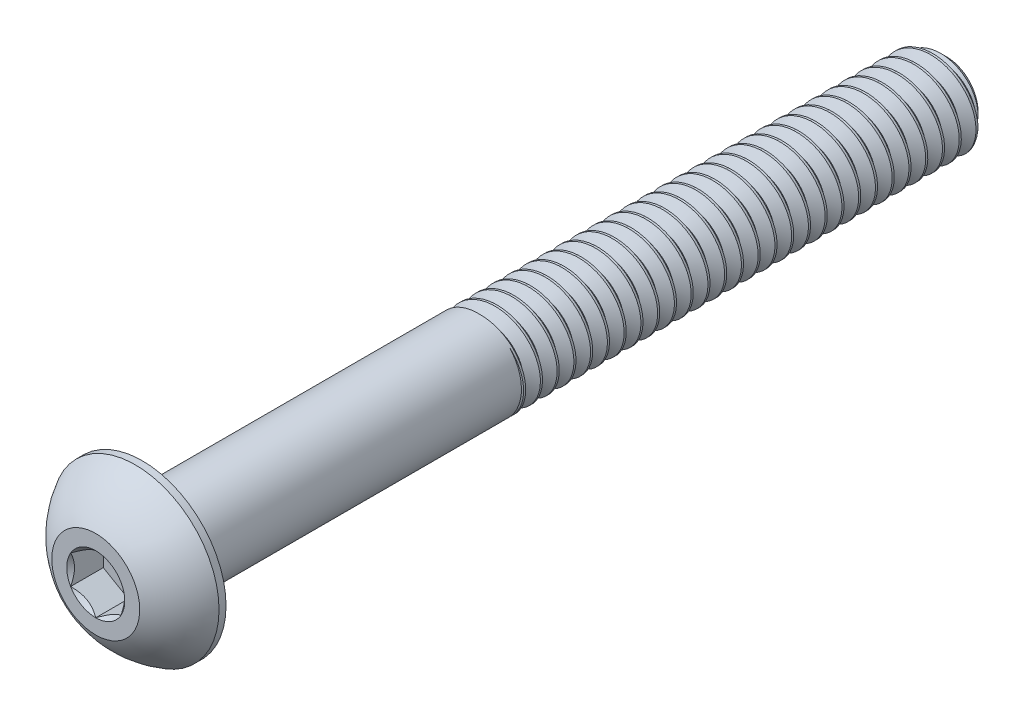
from build123d import *
from build123d.topology import SkipClean

# Parameters (mm, degrees)
SKETCH1_W           = 38.1
SKETCH1_H           = 2.0828
CHAMFER1_SIZE       = 0.5953125
CUT_SWEEP1_PITCH    = 0.79375
CUT_EXTRUDE2_DEPTH  = 1.54686
BOSS_EXTRUDE2_START = -15.875
SKETCH9_R           = 2.0828
BOSS_EXTRUDE2_DEPTH = 15.875


with BuildPart() as part:
    # Sketch1 → Revolve1 (revolve)
    with BuildSketch(Plane(origin=(0, 0, 0), x_dir=(0, 0, -1), z_dir=(1, 0, 0))):
        with Locations((21.2598, 1.0414)):
            Rectangle(SKETCH1_W, SKETCH1_H)
    revolve(axis=Axis((0, 0, -40.3098), (0, 0, 1)))

    # Chamfer1
    chamfer1_edges = [part.edges().sort_by_distance(p)[0] for p in [
        (0, -2.0828, -40.3098),
    ]]
    chamfer(chamfer1_edges, length=CHAMFER1_SIZE)

    # Cut-Sweep1: arcs per turn and ends read off the stored shape
    # Cut-Sweep1: the profile of Sketch2 profile screwed along a right-hand helix through 49 turns, 8 arcs to a turn; built about Z, then put on its axis
    cut_sweep1_z = Axis((0, 0, 0), (0, 0, 1))
    cut_sweep1_corners = [(2.0831, 0, 0.000173205), (2.0831, 0, -0.694704455), (1.567244252, 0, -0.396875), (1.567244252, 0, -0.29765625)]
    with BuildLine(mode=Mode.PRIVATE) as cut_sweep1_profile:
        Line(cut_sweep1_corners[0], cut_sweep1_corners[1])
        Line(cut_sweep1_corners[1], cut_sweep1_corners[2])
        Line(cut_sweep1_corners[2], cut_sweep1_corners[3])
        Line(cut_sweep1_corners[3], cut_sweep1_corners[0])
    cut_sweep1_cap = Face(cut_sweep1_profile.wire())
    cut_sweep1_turn_angles = [0, 22.5, 45, 67.5, 90, 112.5, 135, 157.5, 180, 202.5, 225, 247.5, 270, 292.5, 315, 337.5, 360]
    cut_sweep1_turn_weights = [1, 0.9238795325112867, 1, 0.9238795325112867, 1, 0.9238795325112867, 1, 0.9238795325112867, 1, 0.9238795325112867, 1, 0.9238795325112867, 1, 0.9238795325112867, 1, 0.9238795325112867, 1]
    cut_sweep1_turn_rails = [Edge.make_bspline([Vector(p[0], p[1], 0).rotate(cut_sweep1_z, cut_sweep1_turn_angles[k]) / cut_sweep1_turn_weights[k] + Vector(0, 0, p[2] + CUT_SWEEP1_PITCH * cut_sweep1_turn_angles[k] / 360) for k in range(17)], [0, 0, 0, 1, 1, 2, 2, 3, 3, 4, 4, 5, 5, 6, 6, 7, 7, 8, 8, 8], 2, cut_sweep1_turn_weights) for p in cut_sweep1_corners]
    cut_sweep1_turn_sides = [Face.make_surface_from_curves(cut_sweep1_turn_rails[p[0]], cut_sweep1_turn_rails[p[1]]) for p in [(0, 1), (1, 2), (2, 3), (3, 0)]]
    cut_sweep1 = Plane(origin=(0, 0, -40.3098), x_dir=(0, 1, 0), z_dir=(0, 0, 1)) * Solid(Shell([*[p.moved(Location((0, 0, CUT_SWEEP1_PITCH * i))) for i in range(49) for p in cut_sweep1_turn_sides], cut_sweep1_cap, cut_sweep1_cap.rotate(cut_sweep1_z, 17640).moved(Location((0, 0, CUT_SWEEP1_PITCH * 17640 / 360)))]))
    add(cut_sweep1, mode=Mode.SUBTRACT)

    # Sketch7 → Revolve2 (revolve)
    with BuildSketch(Plane(origin=(0, 0, 0), x_dir=(0, 0, -1), z_dir=(1, 0, 0))):
        with BuildLine():
            Line((1.87833, 3.9624), (2.2098, 3.9624))
            Line((2.2098, 3.9624), (2.2098, 0))
            Line((2.2098, 0), (0, 0))
            Line((0, 0), (0, 2.0828))
            ThreePointArc((0, 2.0828), (0.796523813, 3.165144808), (1.87833, 3.9624))
        make_face()
    revolve(axis=Axis((0, 0, 0), (0, 0, -1)))

    # Sketch5 → Cut-Extrude2 (cut)
    with BuildSketch(Plane.XY):
        Polygon((1.190625, -0.687407664), (1.190625, 0.687407664), (0, 1.374815329), (-1.190625, 0.687407664), (-1.190625, -0.687407664), (0, -1.374815329), align=None)
    extrude(amount=-CUT_EXTRUDE2_DEPTH, mode=Mode.SUBTRACT)

    # Cut-Extrude3 cone 1 section (through the dimple's axis) → Cut-Extrude3 (revolve, cut)
    with BuildSketch(Plane(origin=(0, 0, 0), x_dir=(0, -1, 0), z_dir=(1, 0, 0))):
        Polygon((0, 0), (1.374815329, 0), (0, 1.374815329), align=None)
    revolve(axis=Axis((0, 0, 0), (0, 0, -1)), mode=Mode.SUBTRACT)

    # Sketch9 → Boss-Extrude2 (add)
    with SkipClean():  # the faces are left unmerged after this step: merging them gives an invalid solid
        with BuildSketch(Plane.XY.offset(-2.2098).offset(BOSS_EXTRUDE2_START)):
            with Locations(Location((0, 0, 0), (0, 0, 90))):
                Circle(SKETCH9_R)
        extrude(amount=BOSS_EXTRUDE2_DEPTH)


solid = part.part
